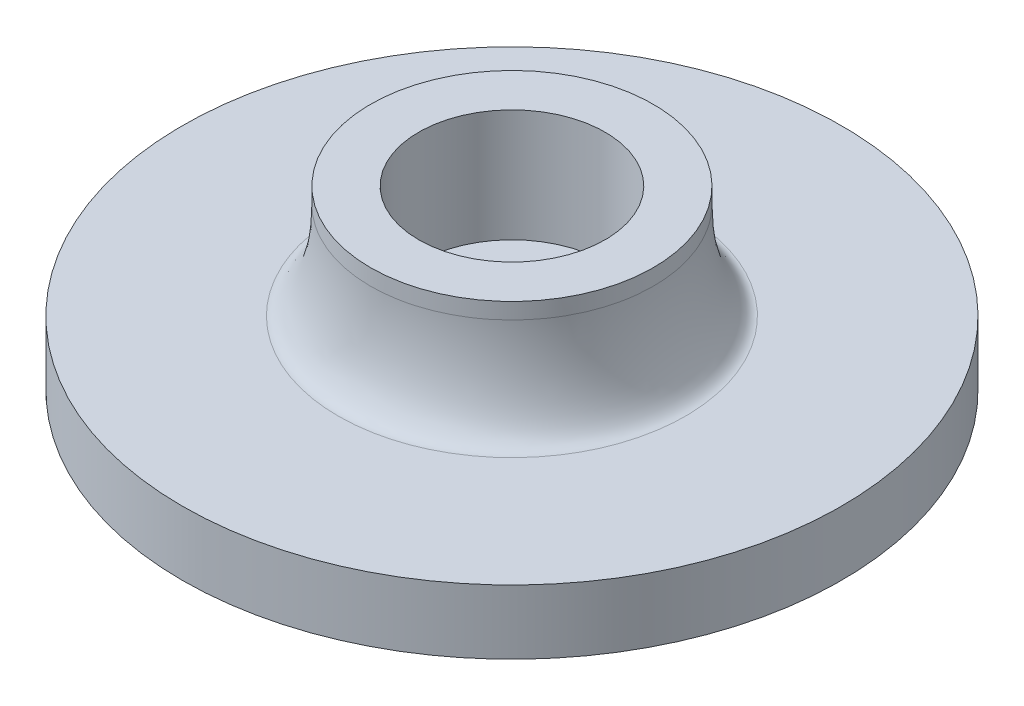
from build123d import *

# Parameters (mm, degrees)
SKETCH1_R           = 10.25
BOSS_EXTRUDE1_DEPTH = 2
SKETCH2_R           = 4.4
SKETCH2_R_2         = 2.9
BOSS_EXTRUDE2_DEPTH = 3.5
FILLET1_SIZE        = 1
FILLET1_SIZE_2      = 3
SKETCH3_R           = 1.5
CUT_EXTRUDE1_DEPTH  = 2


with BuildPart() as part:
    # Sketch1 → Boss-Extrude1 (new body)
    with BuildSketch(Plane(origin=(0, 0, 0), x_dir=(1, 0, 0), z_dir=(0, 1, 0))):
        with Locations(Location((0, 0, 0), (0, 0, 270))):
            Circle(SKETCH1_R)
    extrude(amount=BOSS_EXTRUDE1_DEPTH)

    # Sketch2 → Boss-Extrude2 (add)
    with BuildSketch(Plane(origin=(0, 2, 0), x_dir=(1, 0, 0), z_dir=(0, 1, 0))):
        with Locations(Location((0, 0, 0), (0, 0, 270))):
            Circle(SKETCH2_R)
        with Locations(Location((0, 0, 0), (0, 0, 270))):
            Circle(SKETCH2_R_2, mode=Mode.SUBTRACT)
    extrude(amount=BOSS_EXTRUDE2_DEPTH)

    # Fillet1
    # an asymmetric fillet: 3, 1 mm, written as the material it adds along each edge
    with BuildSketch(Plane(origin=(0, 2, 0), x_dir=(0, 0, 1), z_dir=(-1, 0, 0))) as fillet1_piece_1:
        with BuildLine():
            Bezier((4.4 + FILLET1_SIZE, 0), (4.4, 0), (4.4, FILLET1_SIZE_2), weights=[1, 0.707106781, 1])
            Line((4.4, FILLET1_SIZE_2), (4.4, 0))
            Line((4.4, 0), (4.4 + FILLET1_SIZE, 0))
        make_face()
    revolve(axis=Axis((0, 2, 0), (0, 1, 0)))

    # Sketch3 → Cut-Extrude1 (cut)
    with BuildSketch(Plane.XZ):
        with Locations(Location((0, 0, 0), (0, 0, 270))):
            Circle(SKETCH3_R)
    extrude(amount=-CUT_EXTRUDE1_DEPTH, mode=Mode.SUBTRACT)


solid = part.part
